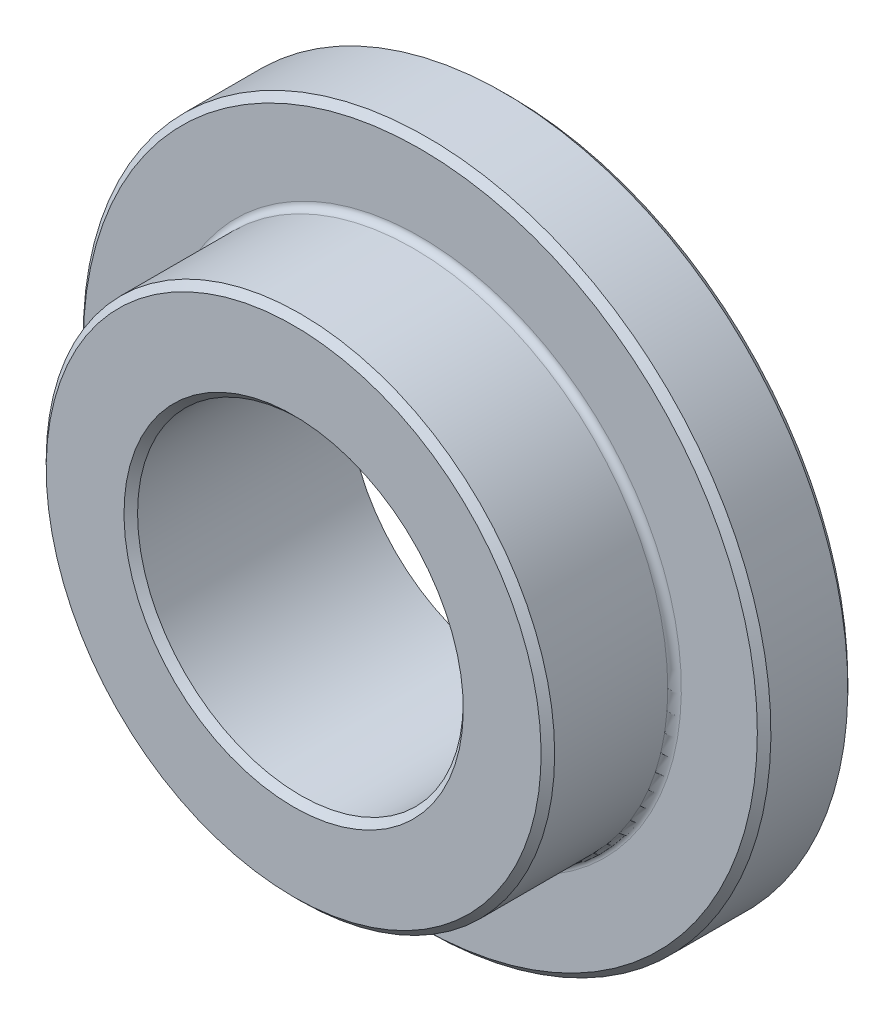
from build123d import *

# Parameters (mm, degrees)
CHAMFER1_SIZE = 0.1875
FILLET1_R     = 0.1875


with BuildPart() as part:
    # Sketch3 → Revolve1 (revolve)
    with BuildSketch(Plane(origin=(0, 0, 0), x_dir=(0, 0, -1), z_dir=(1, 0, 0))):
        Polygon((3, 9.5), (0.5, 9.5), (0.5, 7.025), (-3, 7.025), (-3, 4.5), (3, 4.5), align=None)
    revolve(axis=Axis((0, 0, -3), (0, 0, 1)))

    # Chamfer1
    chamfer1_edges = [part.edges().sort_by_distance(p)[0] for p in [
        (0, -9.5, -3),
        (0, -9.5, -0.5),
        (0, -7.025, 3),
        (0, -4.5, 3),
    ]]
    chamfer(chamfer1_edges, length=CHAMFER1_SIZE)

    # Fillet1
    fillet1_edges = [part.edges().sort_by_distance(p)[0] for p in [
        (0, -7.025, -0.5),
    ]]
    fillet(fillet1_edges, radius=FILLET1_R)


solid = part.part
